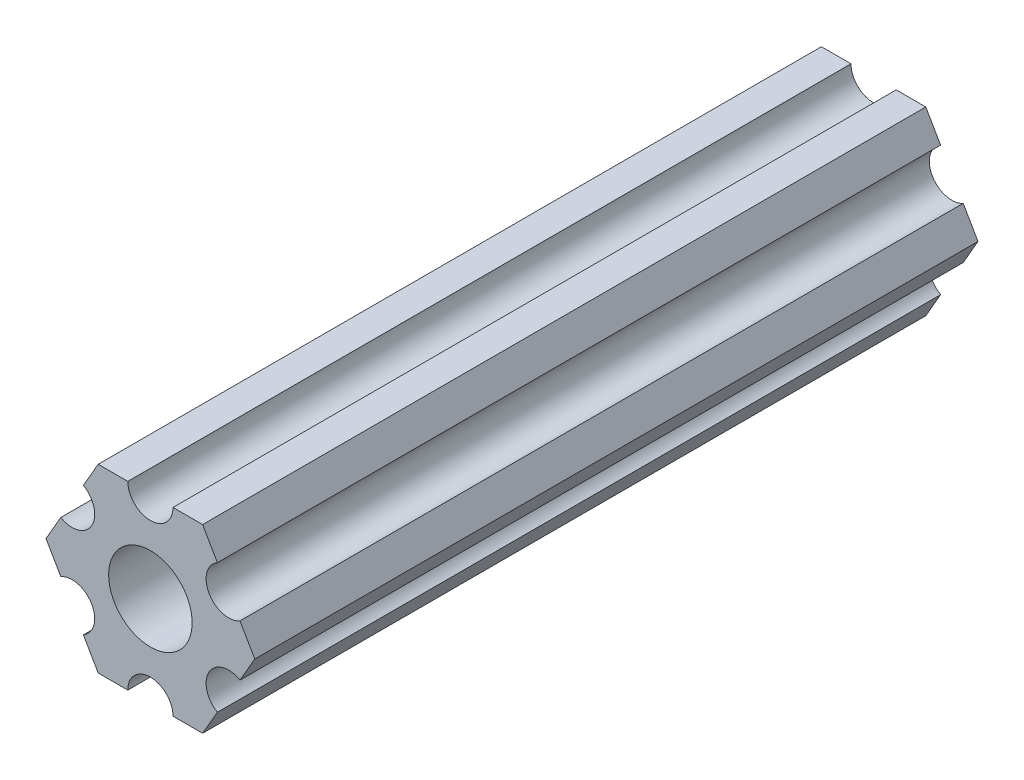
from build123d import *

# Parameters (mm, degrees)
SKETCH1_R           = 2.9337
BOSS_EXTRUDE1_DEPTH = 50.8


with BuildPart() as part:
    # Sketch1 → Boss-Extrude1 (new body)
    with BuildSketch(Plane.XY):
        with BuildLine():
            Line((-4.70551159, -4.549815043), (-3.666174521, -6.349999904))
            Line((-3.666174521, -6.349999904), (-1.587501539, -6.349999904))
            ThreePointArc((-1.587501539, -6.349999904), (-3.85e-07, -4.76249875), (1.587501539, -6.349999904))
            Line((1.587501539, -6.349999904), (3.666173825, -6.349999904))
            Line((3.666173825, -6.349999904), (4.705510929, -4.549815232))
            ThreePointArc((4.705510929, -4.549815232), (4.124445601, -2.381249904), (6.293010929, -1.800184575))
            Line((6.293010929, -1.800184575), (7.332348034, 9.6e-08))
            Line((7.332348034, 9.6e-08), (6.293011178, 1.800184715))
            ThreePointArc((6.293011178, 1.800184715), (4.124445902, 2.381250241), (4.705511428, 4.549815516))
            Line((4.705511428, 4.549815516), (3.666174521, 6.350000222))
            Line((3.666174521, 6.350000222), (1.587498461, 6.350000222))
            ThreePointArc((1.587498461, 6.350000222), (3.85e-07, 4.762502146), (-1.587498461, 6.350000222))
            Line((-1.587498461, 6.350000222), (-3.666173825, 6.350000222))
            Line((-3.666173825, 6.350000222), (-4.705511038, 4.549815614))
            ThreePointArc((-4.705511038, 4.549815614), (-4.124445841, 2.38125025), (-6.293011205, 1.800185053))
            Line((-6.293011205, 1.800185053), (-7.332348419, 4.44e-07))
            Line((-7.332348419, 4.44e-07), (-6.293011423, -1.80018429))
            ThreePointArc((-6.293011423, -1.80018429), (-4.12444613, -2.38124975), (-4.70551159, -4.549815043))
        make_face()
        Circle(SKETCH1_R, mode=Mode.SUBTRACT)
    extrude(amount=-BOSS_EXTRUDE1_DEPTH)


solid = part.part
